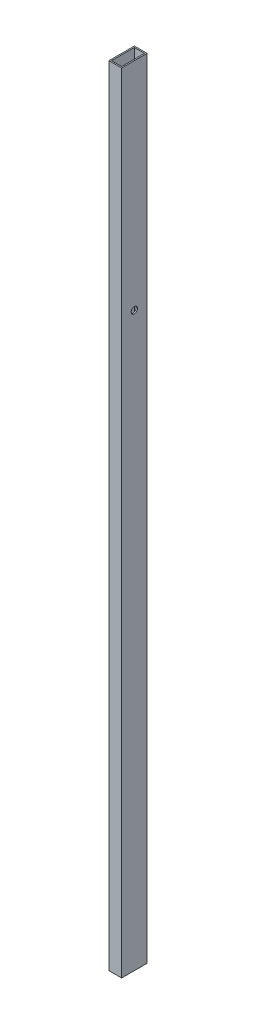
from build123d import *

# Parameters (mm, degrees)
SKETCH_1_W          = 20
SKETCH_1_H          = 40
SKETCH_1_W_2        = 16
SKETCH_1_H_2        = 36
EXTRUDE_1_DEPTH     = 1240
SKETCH_2_R          = 5
CUT_EXTRUDE_1_DEPTH = 1241.322538697
SKETCH_3_R          = 5
CUT_EXTRUDE_2_DEPTH = 10


with BuildPart() as part:
    # Эскиз1 → Вытянуть-Тонкостенный1 (new body)
    with BuildSketch(Plane(origin=(0, 0, 0), x_dir=(1, 0, 0), z_dir=(0, 1, 0))):
        Rectangle(SKETCH_1_W, SKETCH_1_H)
        Rectangle(SKETCH_1_W_2, SKETCH_1_H_2, mode=Mode.SUBTRACT)
    extrude(amount=EXTRUDE_1_DEPTH)

    # Эскиз2 → Вырез-Вытянуть1 (cut, through all)
    with BuildSketch(Plane(origin=(10, 0, 0), x_dir=(0, 0, -1), z_dir=(1, 0, 0))):
        with Locations((0, 900)):
            Circle(SKETCH_2_R)
    extrude(amount=-CUT_EXTRUDE_1_DEPTH, mode=Mode.SUBTRACT)

    # Эскиз3 → Вырез-Вытянуть2 (cut)
    with BuildSketch(Plane.ZY.offset(10)):
        with Locations((0, 860)):
            Circle(SKETCH_3_R)
        with Locations((0, 720)):
            Circle(SKETCH_3_R)
        with Locations((0, 580)):
            Circle(SKETCH_3_R)
    extrude(amount=-CUT_EXTRUDE_2_DEPTH, mode=Mode.SUBTRACT)


solid = part.part
